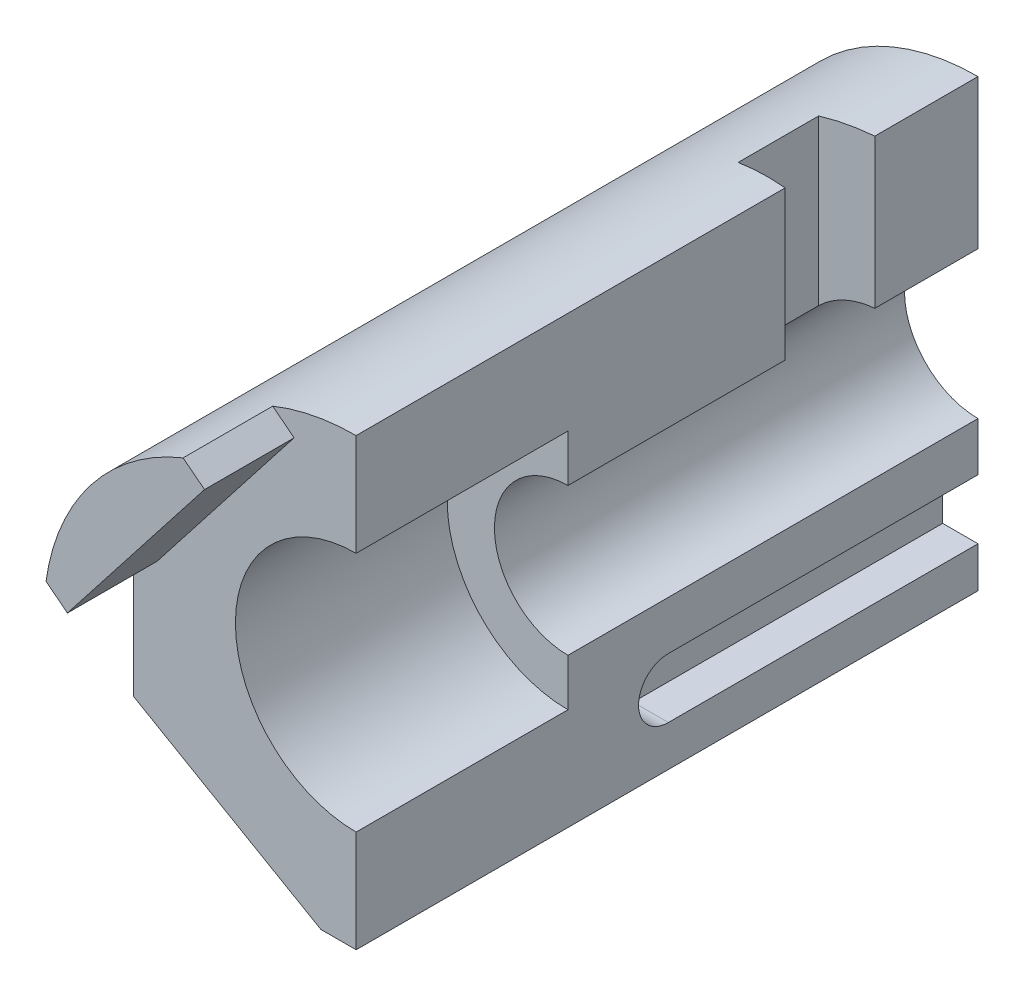
from build123d import *

# Parameters (mm, degrees)
BOSS_EXTRUDE1_DEPTH = 229
CUT_EXTRUDE1_DEPTH  = 78
CUT_EXTRUDE2_DEPTH  = 238.531050602
CUT_EXTRUDE3_DEPTH  = 13
BOSS_EXTRUDE5_DEPTH = 33
CUT_EXTRUDE11_REACH = 321.787


with BuildPart() as part:
    # Sketch1 → Boss-Extrude1 (new body)
    with BuildSketch(Plane.XY):
        with BuildLine():
            Line((0, 0), (0, 164))
            ThreePointArc((0, 164), (-57.982756057, 139.982756057), (-82, 82))
            Line((-82, 82), (-82, 39.837168574))
            Line((-82, 39.837168574), (-13, 0))
            Line((-13, 0), (0, 0))
        make_face()
    extrude(amount=BOSS_EXTRUDE1_DEPTH)

    # Sketch2 → Cut-Extrude1 (cut)
    with BuildSketch(Plane.XY.offset(229)):
        with BuildLine():
            Line((0, 126.45), (0, 37.55))
            ThreePointArc((0, 37.55), (-44.45, 82), (0, 126.45))
        make_face()
    extrude(amount=-CUT_EXTRUDE1_DEPTH, mode=Mode.SUBTRACT)

    # Sketch3 → Cut-Extrude2 (cut, through all)
    with BuildSketch(Plane.XY.offset(151)):
        with BuildLine():
            Line((0, 109.075), (0, 54.925))
            ThreePointArc((0, 54.925), (-27.075, 82), (0, 109.075))
        make_face()
    extrude(amount=-CUT_EXTRUDE2_DEPTH, mode=Mode.SUBTRACT)

    # Sketch4 → Cut-Extrude3 (cut)
    with BuildSketch(Plane(origin=(0, 0, 0), x_dir=(0, 0, -1), z_dir=(1, 0, 0))):
        with BuildLine():
            Line((0, 37), (-114, 37))
            ThreePointArc((-114, 37), (-125, 26), (-114, 15))
            Line((-114, 15), (0, 15))
            Line((0, 15), (0, 37))
        make_face()
    extrude(amount=-CUT_EXTRUDE3_DEPTH, mode=Mode.SUBTRACT)

    # Sketch8<5> → Boss-Extrude5 (add)
    with BuildSketch(Plane.XY.offset(229)):
        with BuildLine():
            ThreePointArc((-30.71774066, 158.029076074), (-64.616881796, 132.484240977), (-81.201981637, 93.412194279))
            Line((-81.201981637, 93.412194279), (-73.310776458, 87.246909097))
            Line((-73.310776458, 87.246909097), (-22.826535482, 151.863790893))
            Line((-22.826535482, 151.863790893), (-30.71774066, 158.029076074))
        make_face()
    extrude(amount=BOSS_EXTRUDE5_DEPTH)

    # Sketch20 → Cut-Extrude11 (cut, up to next)
    with BuildSketch(Plane(origin=(0, 164, 0), x_dir=(1, 0, 0), z_dir=(0, 1, 0)), mode=Mode.PRIVATE) as cut_extrude11_sk1:
        Polygon((0, -38), (0, -71), (-19, -69.337715393), (-19, -39.662284607), align=None)
    cut_extrude11_tool1 = extrude(cut_extrude11_sk1.sketch, amount=-CUT_EXTRUDE11_REACH, mode=Mode.PRIVATE) & part.part
    add(cut_extrude11_tool1.solids().sort_by_distance((-9.332027, 164, 54.5))[0], mode=Mode.SUBTRACT)


solid = part.part
